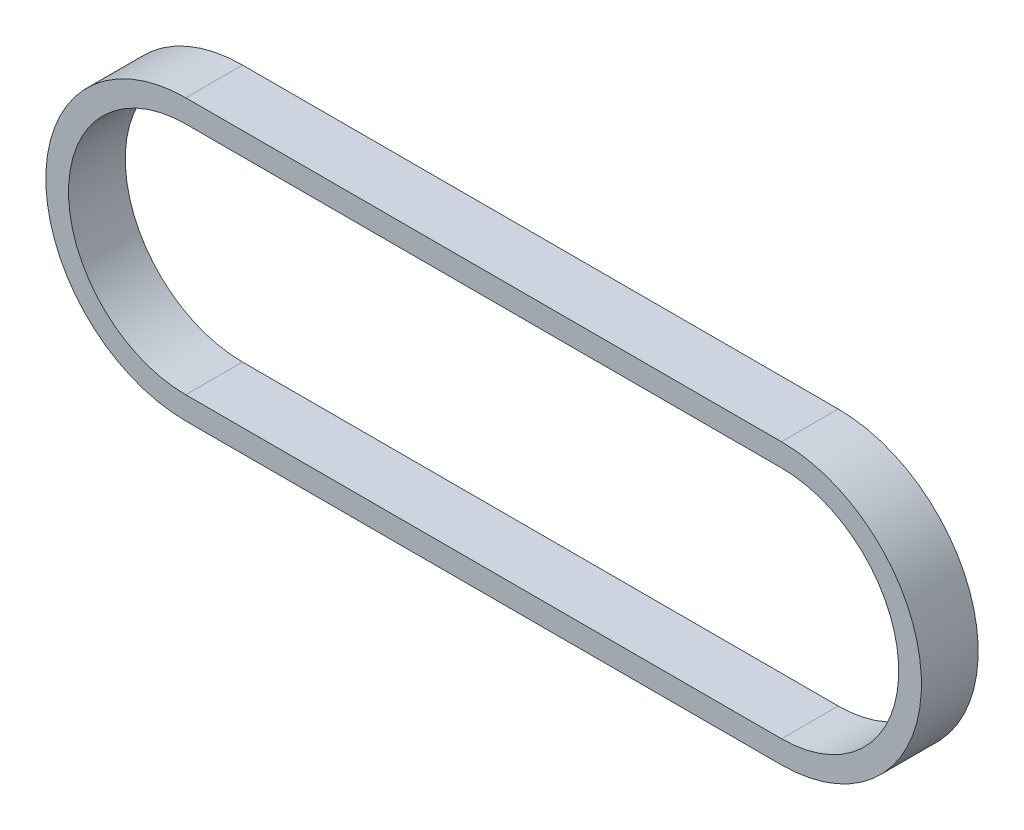
from build123d import *

# Parameters (mm, degrees)
BOSS_EXTRU_1_DEPTH = 6


with BuildPart() as part:
    # Esquisse1 → Boss.-Extru.1 (new body)
    with BuildSketch(Plane.XY):
        with BuildLine():
            Line((0, 14.8), (63, 14.8))
            ThreePointArc((63, 14.8), (77.8, 0), (63, -14.8))
            Line((63, -14.8), (0, -14.8))
            ThreePointArc((0, -14.8), (-14.8, 0), (0, 14.8))
        make_face()
        with BuildLine():
            Line((0, 12.4), (63, 12.4))
            ThreePointArc((63, 12.4), (75.4, 0), (63, -12.4))
            Line((63, -12.4), (0, -12.4))
            ThreePointArc((0, -12.4), (-12.4, 0), (0, 12.4))
        make_face(mode=Mode.SUBTRACT)
    extrude(amount=BOSS_EXTRU_1_DEPTH)


solid = part.part
